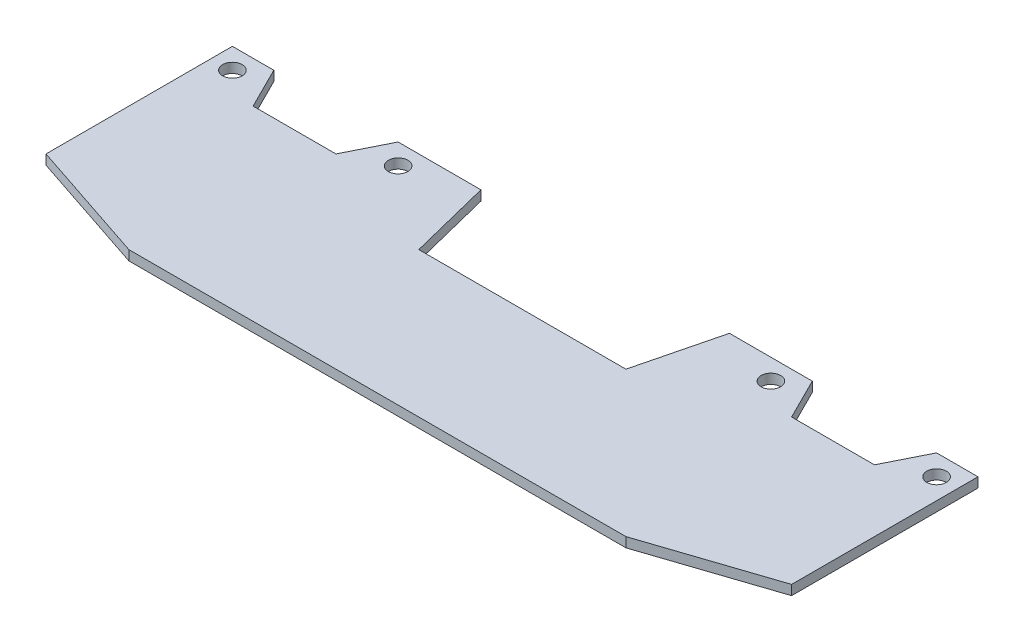
from build123d import *

# Parameters (mm, degrees)
BOSS_EXTRUDE1_DEPTH = 1.498487888
SKETCH2_R           = 1.5
CUT_EXTRUDE1_DEPTH  = 60.777143393
CUT_EXTRUDE2_DEPTH  = 60.777143393


with BuildPart() as part:
    # Sketch1 → Boss-Extrude1 (new body)
    with BuildSketch(Plane(origin=(0, 0, 0), x_dir=(1, 0, 0), z_dir=(0, 1, 0))):
        Polygon((-57.15, -11.1125), (-38.1, -17.4625), (38.1, -17.4625), (57.15, -11.1125), (57.15, 17.4625), (19.05, 17.4625), (15.875, 4.7625), (-15.875, 4.7625), (-19.05, 17.4625), (-57.15, 17.4625), align=None)
    extrude(amount=BOSS_EXTRUDE1_DEPTH)

    # Sketch2 → Cut-Extrude1 (cut, through all)
    with BuildSketch(Plane(origin=(0, 1.498487888, 0), x_dir=(1, 0, 0), z_dir=(0, 1, 0))):
        with Locations((-53.975, 14.2875)):
            Circle(SKETCH2_R)
        with Locations((-28.575, 14.2875)):
            Circle(SKETCH2_R)
    cut_extrude1 = extrude(amount=-CUT_EXTRUDE1_DEPTH, mode=Mode.SUBTRACT)

    # Sketch5 → Cut-Extrude2 (cut, through all)
    with BuildSketch(Plane(origin=(0, 1.498487888, 0), x_dir=(1, 0, 0), z_dir=(0, 1, 0))):
        Polygon((-50.8, 17.4625), (-47.625, 11.1125), (-34.925, 11.1125), (-31.75, 17.4625), align=None)
    cut_extrude2 = extrude(amount=-CUT_EXTRUDE2_DEPTH, mode=Mode.SUBTRACT)

    # Mirror1: Cut-Extrude1, Cut-Extrude2 across plane
    add(cut_extrude1.mirror(Plane(origin=(0, 0, 0), x_dir=(0, 0, 1), z_dir=(1, 0, 0))), mode=Mode.SUBTRACT)
    add(cut_extrude2.mirror(Plane(origin=(0, 0, 0), x_dir=(0, 0, 1), z_dir=(1, 0, 0))), mode=Mode.SUBTRACT)


solid = part.part
